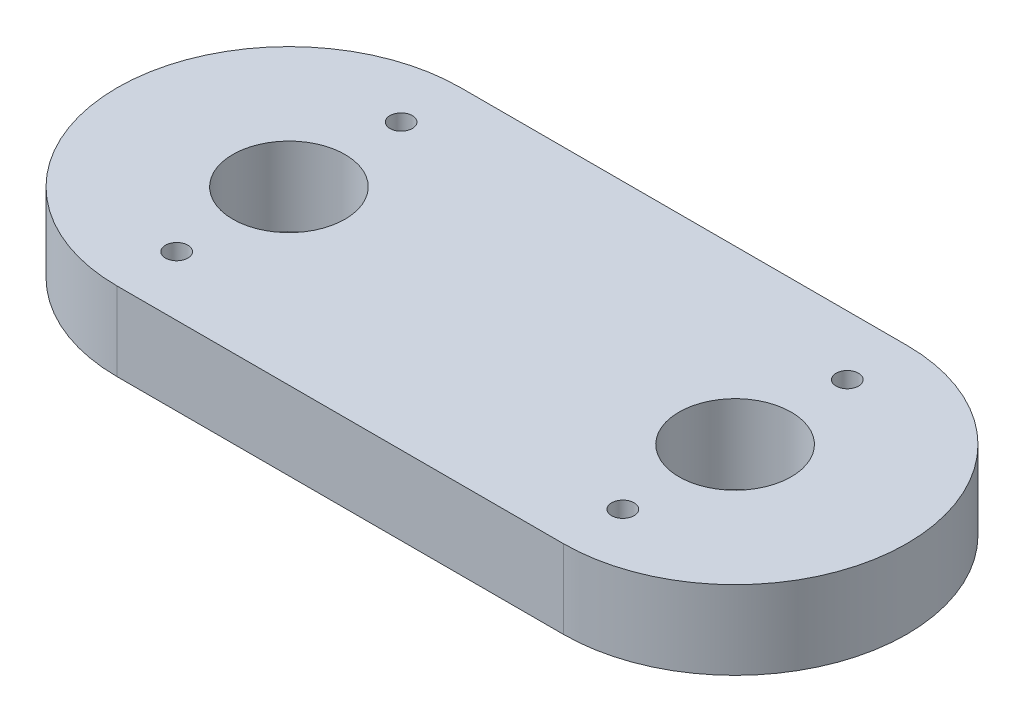
from build123d import *

# Parameters (mm, degrees)
BOSS_EXTRUDE1_DEPTH = 7
SKETCH2_R           = 5
SKETCH2_R_2         = 1
CUT_EXTRUDE1_DEPTH  = 57.755476373


with BuildPart() as part:
    # Sketch1 → Boss-Extrude1 (new body)
    with BuildSketch(Plane(origin=(0, 0, 0), x_dir=(1, 0, 0), z_dir=(0, 1, 0))):
        with BuildLine():
            Line((-31.972318339, 0), (7.785985851, 0))
            ThreePointArc((7.785985851, 0), (23.091295391, -15.30530954), (7.785985851, -30.61061908))
            Line((7.785985851, -30.61061908), (-31.972318339, -30.61061908))
            ThreePointArc((-31.972318339, -30.61061908), (-47.277627879, -15.30530954), (-31.972318339, 0))
        make_face()
    extrude(amount=BOSS_EXTRUDE1_DEPTH)

    # Sketch2 → Cut-Extrude1 (cut, through all)
    with BuildSketch(Plane(origin=(0, 7, 0), x_dir=(1, 0, 0), z_dir=(0, 1, 0))):
        with Locations((-31.972318339, -15.30530954)):
            Circle(SKETCH2_R)
        with Locations((-31.972318339, -5.30530954)):
            Circle(SKETCH2_R_2)
        with Locations((-31.972318339, -25.30530954)):
            Circle(SKETCH2_R_2)
        with Locations((7.785985851, -5.30530954)):
            Circle(SKETCH2_R_2)
        with Locations((7.785985851, -15.30530954)):
            Circle(SKETCH2_R)
        with Locations((7.785985851, -25.30530954)):
            Circle(SKETCH2_R_2)
    extrude(amount=-CUT_EXTRUDE1_DEPTH, mode=Mode.SUBTRACT)


solid = part.part
